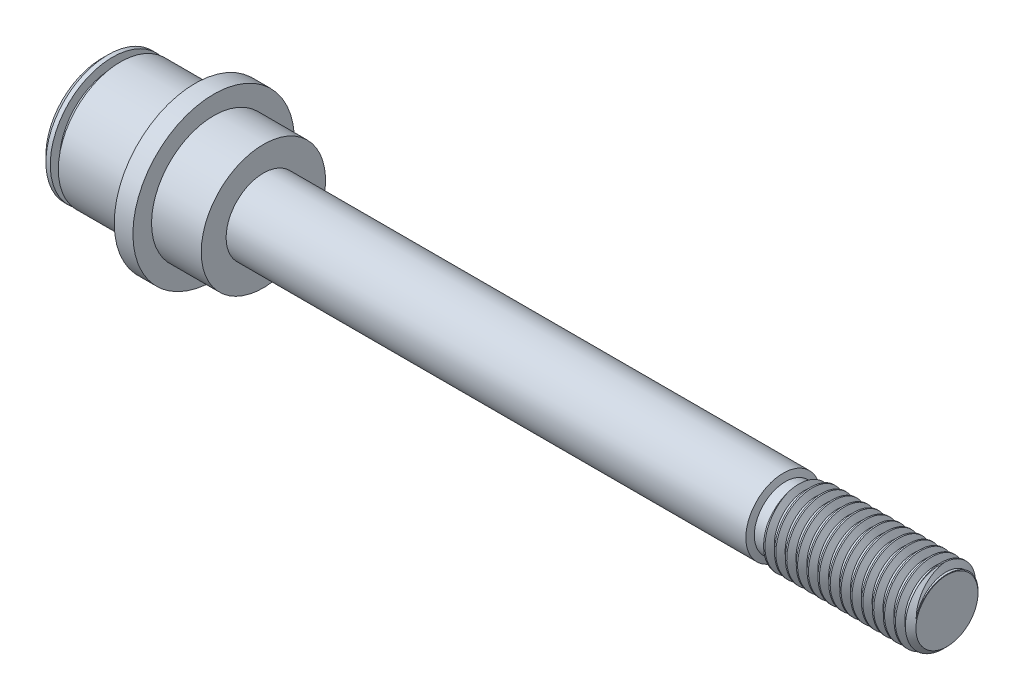
from build123d import *

# Parameters (mm, degrees)
CHAMFER1_SIZE = 1
THREAD1_PITCH = 1.75
SKETCH16_W    = 1.3
SKETCH16_H    = 3


with BuildPart() as part:
    # Sketch2 → Revolve3 (revolve)
    with BuildSketch(Plane.XY, mode=Mode.PRIVATE) as revolve3_sk:
        Polygon((0, 0), (136, 0), (136, 6), (26, 6), (26, 10), (18, 10), (18, 13), (15, 13), (15, 10), (0, 10), align=None)
    revolve(revolve3_sk.sketch.rotate(Axis((0, 0, 0), (1, 0, 0)), 90), axis=Axis((0, 0, 0), (1, 0, 0)))

    # Chamfer1
    chamfer1_edges = [part.edges().sort_by_distance(p)[0] for p in [
        (136, 0, -6),
        (0, 0, -10),
    ]]
    chamfer(chamfer1_edges, length=CHAMFER1_SIZE)

    # Thread1: the profile of Thread Profile3 profile screwed along a right-hand helix of 14.285714 turns, 10 arcs to a turn; built about Z, then put on its axis
    thread1_z = Axis((0, 0, 0), (0, 0, 1))
    thread1_corners = [(6.0003, 0, -0.000173205), (6.0003, 0, 1.5314232), (5.052784719, 0, 0.984374998), (5.052784719, 0, 0.546874998)]
    with BuildLine(mode=Mode.PRIVATE) as thread1_profile:
        Line(thread1_corners[0], thread1_corners[1])
        Line(thread1_corners[1], thread1_corners[2])
        Line(thread1_corners[2], thread1_corners[3])
        Line(thread1_corners[3], thread1_corners[0])
    thread1_cap = Face(thread1_profile.wire())
    thread1_turn_angles = [0, 18, 36, 54, 72, 90, 108, 126, 144, 162, 180, 198, 216, 234, 252, 270, 288, 306, 324, 342, 360]
    thread1_turn_weights = [1, 0.9510565162951535, 1, 0.9510565162951535, 1, 0.9510565162951535, 1, 0.9510565162951535, 1, 0.9510565162951535, 1, 0.9510565162951535, 1, 0.9510565162951535, 1, 0.9510565162951535, 1, 0.9510565162951535, 1, 0.9510565162951535, 1]
    thread1_turn_rails = [Edge.make_bspline([Vector(p[0], p[1], 0).rotate(thread1_z, thread1_turn_angles[k]) / thread1_turn_weights[k] + Vector(0, 0, p[2] + THREAD1_PITCH * thread1_turn_angles[k] / 360) for k in range(21)], [0, 0, 0, 1, 1, 2, 2, 3, 3, 4, 4, 5, 5, 6, 6, 7, 7, 8, 8, 9, 9, 10, 10, 10], 2, thread1_turn_weights) for p in thread1_corners]
    thread1_turn_sides = [Face.make_surface_from_curves(thread1_turn_rails[p[0]], thread1_turn_rails[p[1]]) for p in [(0, 1), (1, 2), (2, 3), (3, 0)]]
    thread1_last_angles = [5040, 5058, 5076, 5094, 5112, 5127.428571429, 5142.857142857]
    thread1_last_weights = [1, 0.9510565162951535, 1, 0.9510565162951535, 1, 0.9639628606958527, 1]
    thread1_last_rails = [Edge.make_bspline([Vector(p[0], p[1], 0).rotate(thread1_z, thread1_last_angles[k]) / thread1_last_weights[k] + Vector(0, 0, p[2] + THREAD1_PITCH * thread1_last_angles[k] / 360) for k in range(7)], [0, 0, 0, 1, 1, 2, 2, 3, 3, 3], 2, thread1_last_weights) for p in thread1_corners]
    thread1_last_sides = [Face.make_surface_from_curves(thread1_last_rails[p[0]], thread1_last_rails[p[1]]) for p in [(0, 1), (1, 2), (2, 3), (3, 0)]]
    thread1 = Plane(origin=(137, 0, 0), x_dir=(0, 0, 1), z_dir=(-1, 0, 0)) * Solid(Shell([*[p.moved(Location((0, 0, THREAD1_PITCH * i))) for i in range(14) for p in thread1_turn_sides], *thread1_last_sides, thread1_cap, thread1_cap.rotate(thread1_z, 5142.857142857).moved(Location((0, 0, THREAD1_PITCH * 5142.857142857 / 360)))]))
    add(thread1, mode=Mode.SUBTRACT)

    # Sketch16 → Cut-Revolve1 (revolve, cut)
    with BuildSketch(Plane.XY, mode=Mode.PRIVATE) as cut_revolve1_sk:
        with Locations((2.35, 10)):
            Rectangle(SKETCH16_W, SKETCH16_H)
    revolve(cut_revolve1_sk.sketch.rotate(Axis((0, 0, 0), (1, 0, 0)), 90), axis=Axis((0, 0, 0), (1, 0, 0)), mode=Mode.SUBTRACT)

    # Sketch17 → Cut-Revolve2 (revolve, cut)
    with BuildSketch(Plane.XY, mode=Mode.PRIVATE) as cut_revolve2_sk:
        Polygon((109.454044649, 6.5), (112.545955351, 6.5), (112, 5), (110, 5), align=None)
    revolve(cut_revolve2_sk.sketch.rotate(Axis((0, 0, 0), (1, 0, 0)), 90), axis=Axis((0, 0, 0), (1, 0, 0)), mode=Mode.SUBTRACT)


solid = part.part
